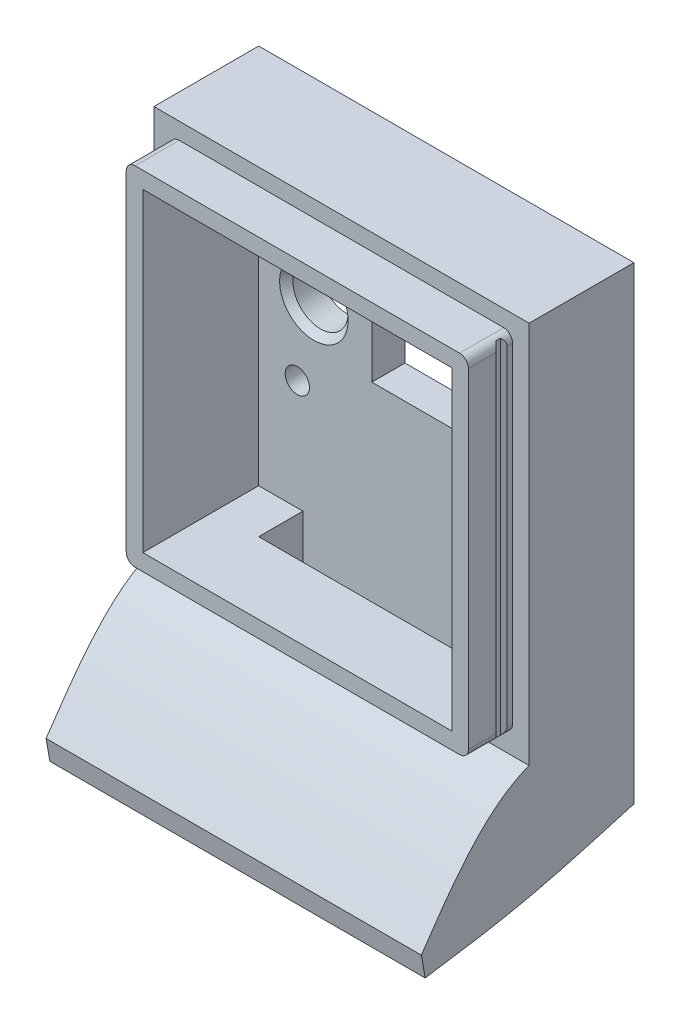
from build123d import *

# Parameters (mm, degrees)
SKETCH1_W           = 34
SKETCH1_H           = 34.5
BOSS_EXTRUDE2_DEPTH = 13.5
SHELL1_T            = -3
SKETCH4_R           = 1.1
SKETCH4_R_2         = 2.5
CUT_EXTRUDE2_DEPTH  = 3
CHAMFER1_SIZE       = 0.6
SKETCH5_W           = 7.5
SKETCH5_H           = 7.5
CUT_EXTRUDE4_DEPTH  = 3
SKETCH6_W           = 34
SKETCH6_H           = 34.5
SKETCH6_W_2         = 31
SKETCH6_H_2         = 31.5
CUT_EXTRUDE5_DEPTH  = 4
FILLET1_R           = 0.8
CUT_EXTRUDE6_DEPTH  = 40.5
SKETCH8_W           = 34
SKETCH8_H           = 9.5
BOSS_EXTRUDE3_DEPTH = 8
LOFT1_START         = -17
LOFT1_DEPTH         = 34
SKETCH2_W           = 20
SKETCH2_H           = 4
CUT_EXTRUDE1_DEPTH  = 15


# Read off the part's stored shape, not the designer's step: Loft1
with BuildPart() as part:
    # Sketch1 → Boss-Extrude2 (new body)
    with BuildSketch(Plane.XY):
        Rectangle(SKETCH1_W, SKETCH1_H)
    extrude(amount=BOSS_EXTRUDE2_DEPTH)

    # Shell1
    shell1_openings = [part.faces().sort_by_distance(p)[0] for p in [
        (0, 0, 13.5),
    ]]
    offset(amount=SHELL1_T, openings=shell1_openings, kind=Kind.INTERSECTION)

    # Sketch4 → Cut-Extrude2 (cut)
    with BuildSketch(Plane.XY.offset(3)):
        with Locations((-10.5, 9.25)):
            Circle(SKETCH4_R)
        with Locations((10.5, 9.25)):
            Circle(SKETCH4_R)
        with Locations((10.5, -4.25)):
            Circle(SKETCH4_R)
        with Locations((-10.5, -4.25)):
            Circle(SKETCH4_R)
        with Locations((-9, 2.75)):
            Circle(SKETCH4_R_2)
        with Locations((9, 2.75)):
            Circle(SKETCH4_R_2)
    extrude(amount=-CUT_EXTRUDE2_DEPTH, mode=Mode.SUBTRACT)

    # Chamfer1
    chamfer1_edges = [part.edges().sort_by_distance(p)[0] for p in [
        (-11.5, 2.75, 3),
        (6.5, 2.75, 3),
    ]]
    chamfer(chamfer1_edges, length=CHAMFER1_SIZE)

    # Sketch5 → Cut-Extrude4 (cut)
    with BuildSketch(Plane.XY.offset(3)):
        with Locations((0, 2.75)):
            Rectangle(SKETCH5_W, SKETCH5_H)
    extrude(amount=-CUT_EXTRUDE4_DEPTH, mode=Mode.SUBTRACT)

    # Sketch6 → Cut-Extrude5 (cut)
    with BuildSketch(Plane.XY.offset(13.5)):
        Rectangle(SKETCH6_W, SKETCH6_H)
        Rectangle(SKETCH6_W_2, SKETCH6_H_2, mode=Mode.SUBTRACT)
    extrude(amount=-CUT_EXTRUDE5_DEPTH, mode=Mode.SUBTRACT)

    # Fillet1
    fillet1_edges = [part.edges().sort_by_distance(p)[0] for p in [
        (15.5, -15.75, 11.5),
        (-15.5, -15.75, 11.5),
        (-15.5, 15.75, 11.5),
        (15.5, 15.75, 11.5),
    ]]
    fillet(fillet1_edges, radius=FILLET1_R)

    # Sketch7 → Cut-Extrude6 (cut, through all)
    with BuildSketch(Plane.XZ.offset(15.75)):
        Polygon((-15.5, 10), (-15.2, 10.3), (-15.2, 10.7), (-15.5, 11), align=None)
        Polygon((15.5, 10), (15.2, 10.3), (15.2, 10.7), (15.5, 11), align=None)
    extrude(amount=-CUT_EXTRUDE6_DEPTH, mode=Mode.SUBTRACT)

    # Sketch8 → Boss-Extrude3 (add)
    with BuildSketch(Plane.XZ.offset(17.25)):
        with Locations((0, 4.75)):
            Rectangle(SKETCH8_W, SKETCH8_H)
    extrude(amount=BOSS_EXTRUDE3_DEPTH)

    # Loft1 outline → Loft1 (add)
    with BuildSketch(Plane.YZ.offset(LOFT1_START)):
        with BuildLine():
            add(Edge.make_bspline(
                [(-27.448962768, 19.266529653), (-23.634638761, 16.661774183), (-19.340130821, 13.729106946), (-17.622252945, 9.933560294), (-17.457544345, 9.499999999)],
                knots=[0, 0, 0, 0, 0.544121998, 0.612621328, 0.612621328, 0.612621328, 0.612621328], degree=3))
            Line((-27.448962768, 19.266529653), (-29.418578274, 18.919233298))
            add(Edge.make_bspline(
                [(-29.418578274, 18.919233298), (-28.949482113, 15.724623902), (-28.092684774, 9.889716149), (-26.137682382, 3.173259559), (-25.25, 0.131617347)],
                knots=[0, 0, 0, 0, 0.544121998, 0.993830941, 0.993830941, 0.993830941, 0.993830941], degree=3))
            Line((-25.25, 0.131617347), (-25.25, 9.5))
            Line((-25.25, 9.5), (-17.457544345, 9.499999999))
        make_face()
    extrude(amount=LOFT1_DEPTH)

    # Sketch2 → Cut-Extrude1 (cut)
    with BuildSketch(Plane(origin=(0, -14.25, 0), x_dir=(1, 0, 0), z_dir=(0, 1, 0))):
        with Locations((0, -5)):
            Rectangle(SKETCH2_W, SKETCH2_H)
    extrude(amount=-CUT_EXTRUDE1_DEPTH, mode=Mode.SUBTRACT)


solid = part.part
